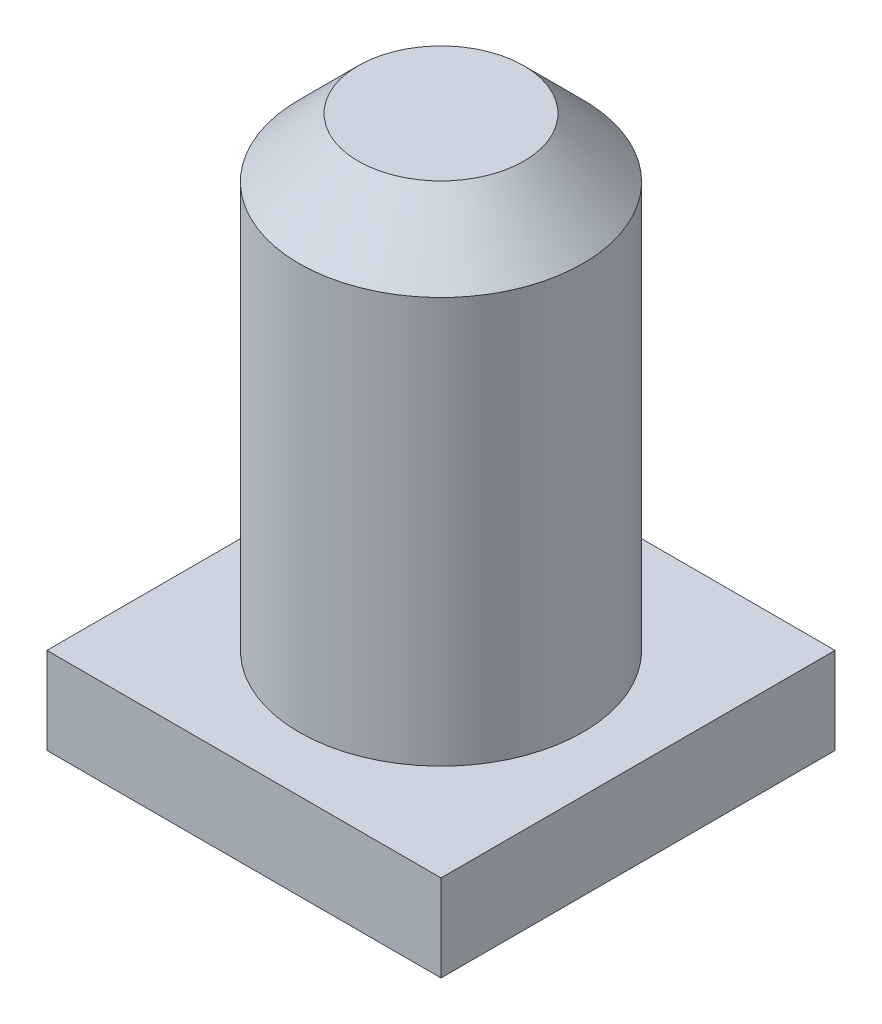
from build123d import *

# Parameters (mm, degrees)
SKETCH1_R           = 1.8
BOSS_EXTRUDE1_DEPTH = 7
SKETCH3_W           = 5
SKETCH3_H           = 5
BOSS_EXTRUDE2_DEPTH = 1.1
CHAMFER1_SIZE       = 0.75


with BuildPart() as part:
    # Sketch1 → Boss-Extrude1 (new body)
    with BuildSketch(Plane(origin=(0, 0, 0), x_dir=(1, 0, 0), z_dir=(0, 1, 0))):
        Circle(SKETCH1_R)
    extrude(amount=BOSS_EXTRUDE1_DEPTH)

    # Sketch3 → Boss-Extrude2 (add)
    with BuildSketch(Plane.XZ):
        Rectangle(SKETCH3_W, SKETCH3_H)
    extrude(amount=-BOSS_EXTRUDE2_DEPTH)

    # Chamfer1
    chamfer1_edges = [part.edges().sort_by_distance(p)[0] for p in [
        (-1.8, 7, 0),
    ]]
    chamfer(chamfer1_edges, length=CHAMFER1_SIZE)


solid = part.part
